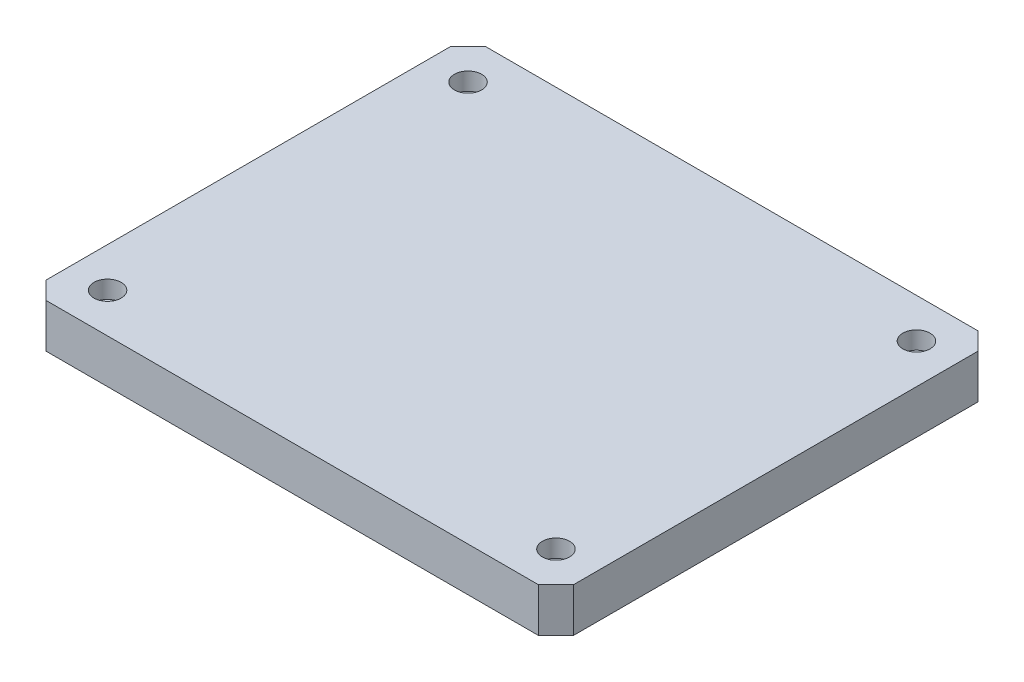
from build123d import *

# Parameters (mm, degrees)
SKETCH1_W           = 60
SKETCH1_H           = 50
BOSS_EXTRUDE1_DEPTH = 5
CHAMFER1_SIZE       = 2
SKETCH2_R           = 1.55
CUT_EXTRUDE1_DEPTH  = 2


with BuildPart() as part:
    # Sketch1 → Boss-Extrude1 (new body)
    with BuildSketch(Plane(origin=(0, 0, 0), x_dir=(1, 0, 0), z_dir=(0, 1, 0))):
        with Locations((30, 25)):
            Rectangle(SKETCH1_W, SKETCH1_H)
    extrude(amount=BOSS_EXTRUDE1_DEPTH)

    # Chamfer1
    chamfer1_edges = [part.edges().sort_by_distance(p)[0] for p in [
        (60, 2.5, 0),
        (60, 2.5, -50),
        (0, 2.5, 0),
        (0, 2.5, -50),
    ]]
    chamfer(chamfer1_edges, length=CHAMFER1_SIZE)

    # Sketch2 → Cut-Extrude1 (cut)
    with BuildSketch(Plane(origin=(0, 5, 0), x_dir=(1, 0, 0), z_dir=(0, 1, 0))):
        with Locations((55.5, 4.5)):
            Circle(SKETCH2_R)
        with Locations((4.5, 4.5)):
            Circle(SKETCH2_R)
        with Locations((4.5, 45.5)):
            Circle(SKETCH2_R)
        with Locations((55.5, 45.5)):
            Circle(SKETCH2_R)
    extrude(amount=-CUT_EXTRUDE1_DEPTH, mode=Mode.SUBTRACT)


solid = part.part
